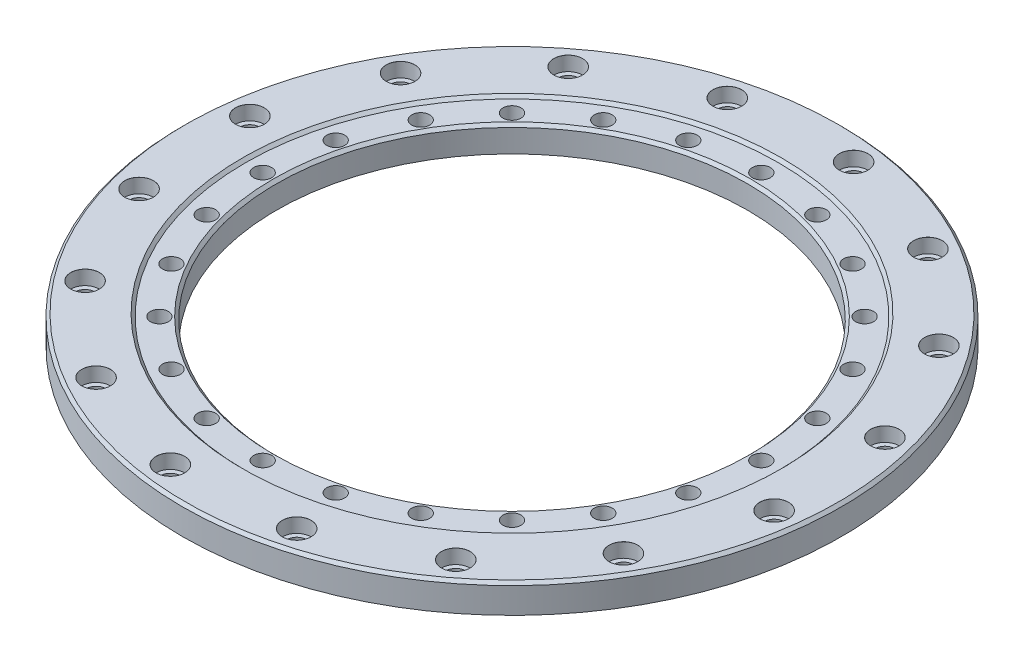
from build123d import *

# Parameters (mm, degrees)
SKETCH2_R          = 6.25
CUT_EXTRUDE3_DEPTH = 20
CIRPATTERN1_COUNT  = 16
CHAMFER1_SIZE      = 2


with BuildPart() as part:
    # Sketch1 → Revolve1 (revolve)
    with BuildSketch(Plane(origin=(0, 0, 0), x_dir=(0, 0, -1), z_dir=(1, 0, 0)), mode=Mode.PRIVATE) as revolve1_sk:
        Polygon((-164.5, 0), (-230, 0), (-230, 20), (-186, 20), (-186, 18), (-164.5, 18), align=None)
    revolve(revolve1_sk.sketch.rotate(Axis((0, 0, 0), (0, 1, 0)), 180), axis=Axis((0, 0, 0), (0, 1, 0)))

    # Sketch2 → Cut-Extrude3 (cut)
    with BuildSketch(Plane(origin=(0, 20, 0), x_dir=(1, 0, 0), z_dir=(0, 1, 0))):
        with Locations(Location((0, 174, 0), (0, 0, 270))):
            Circle(SKETCH2_R)
        with Locations(Location((45.034513848, 168.071093774, 0), (0, 0, 270))):
            Circle(SKETCH2_R)
        with Locations(Location((87, 150.688420258, 0), (0, 0, 270))):
            Circle(SKETCH2_R)
        with Locations(Location((123.036579926, 123.036579926, 0), (0, 0, 270))):
            Circle(SKETCH2_R)
        with Locations(Location((150.688420258, 87, 0), (0, 0, 270))):
            Circle(SKETCH2_R)
        with Locations(Location((168.071093774, 45.034513848, 0), (0, 0, 270))):
            Circle(SKETCH2_R)
        with Locations(Location((174, 0, 0), (0, 0, 270))):
            Circle(SKETCH2_R)
        with Locations(Location((168.071093774, -45.034513848, 0), (0, 0, 270))):
            Circle(SKETCH2_R)
        with Locations(Location((150.688420258, -87, 0), (0, 0, 270))):
            Circle(SKETCH2_R)
        with Locations(Location((123.036579926, -123.036579926, 0), (0, 0, 270))):
            Circle(SKETCH2_R)
        with Locations(Location((87, -150.688420258, 0), (0, 0, 270))):
            Circle(SKETCH2_R)
        with Locations(Location((45.034513848, -168.071093774, 0), (0, 0, 270))):
            Circle(SKETCH2_R)
        with Locations(Location((0, -174, 0), (0, 0, 270))):
            Circle(SKETCH2_R)
        with Locations(Location((-45.034513848, -168.071093774, 0), (0, 0, 270))):
            Circle(SKETCH2_R)
        with Locations(Location((-87, -150.688420258, 0), (0, 0, 270))):
            Circle(SKETCH2_R)
        with Locations(Location((-123.036579926, -123.036579926, 0), (0, 0, 270))):
            Circle(SKETCH2_R)
        with Locations(Location((-150.688420258, -87, 0), (0, 0, 270))):
            Circle(SKETCH2_R)
        with Locations(Location((-168.071093774, -45.034513848, 0), (0, 0, 270))):
            Circle(SKETCH2_R)
        with Locations(Location((-174, 0, 0), (0, 0, 270))):
            Circle(SKETCH2_R)
        with Locations(Location((-168.071093774, 45.034513848, 0), (0, 0, 270))):
            Circle(SKETCH2_R)
        with Locations(Location((-150.688420258, 87, 0), (0, 0, 270))):
            Circle(SKETCH2_R)
        with Locations(Location((-123.036579926, 123.036579926, 0), (0, 0, 270))):
            Circle(SKETCH2_R)
        with Locations(Location((-87, 150.688420258, 0), (0, 0, 270))):
            Circle(SKETCH2_R)
        with Locations(Location((-45.034513848, 168.071093774, 0), (0, 0, 270))):
            Circle(SKETCH2_R)
    extrude(amount=-CUT_EXTRUDE3_DEPTH, mode=Mode.SUBTRACT)

    # Sketch7 → CBORE for M12 SHCS1 (revolve, cut)
    with BuildSketch(Plane(origin=(27.736815847, 20, -210.682033042), x_dir=(0, 0, 1), z_dir=(1, 0, 0))):
        Polygon((0, 0), (0, 20), (6.75, 20), (6.75, 10), (10, 10), (10, 0.025), (10.025, 0), align=None)
    cbore_for_m12_shcs1 = revolve(axis=Axis((27.736815847, 26.35, -210.682033042), (0, -1, 0)), mode=Mode.SUBTRACT)

    # CirPattern1: CBORE for M12 SHCS1 ×16 about axis
    cirpattern1_axis = Axis((0, 0, 0), (0, 1, 0))
    for i in range(1, CIRPATTERN1_COUNT):
        add(cbore_for_m12_shcs1.rotate(cirpattern1_axis, i * 360 / CIRPATTERN1_COUNT), mode=Mode.SUBTRACT)

    # Chamfer1
    chamfer1_edges = [part.edges().sort_by_distance(p)[0] for p in [
        (0, 20, 186),
        (0, 20, 230),
        (0, 18, 164.5),
    ]]
    chamfer(chamfer1_edges, length=CHAMFER1_SIZE - 0.0001)  # a hair under: the kernel refuses the full size


solid = part.part
